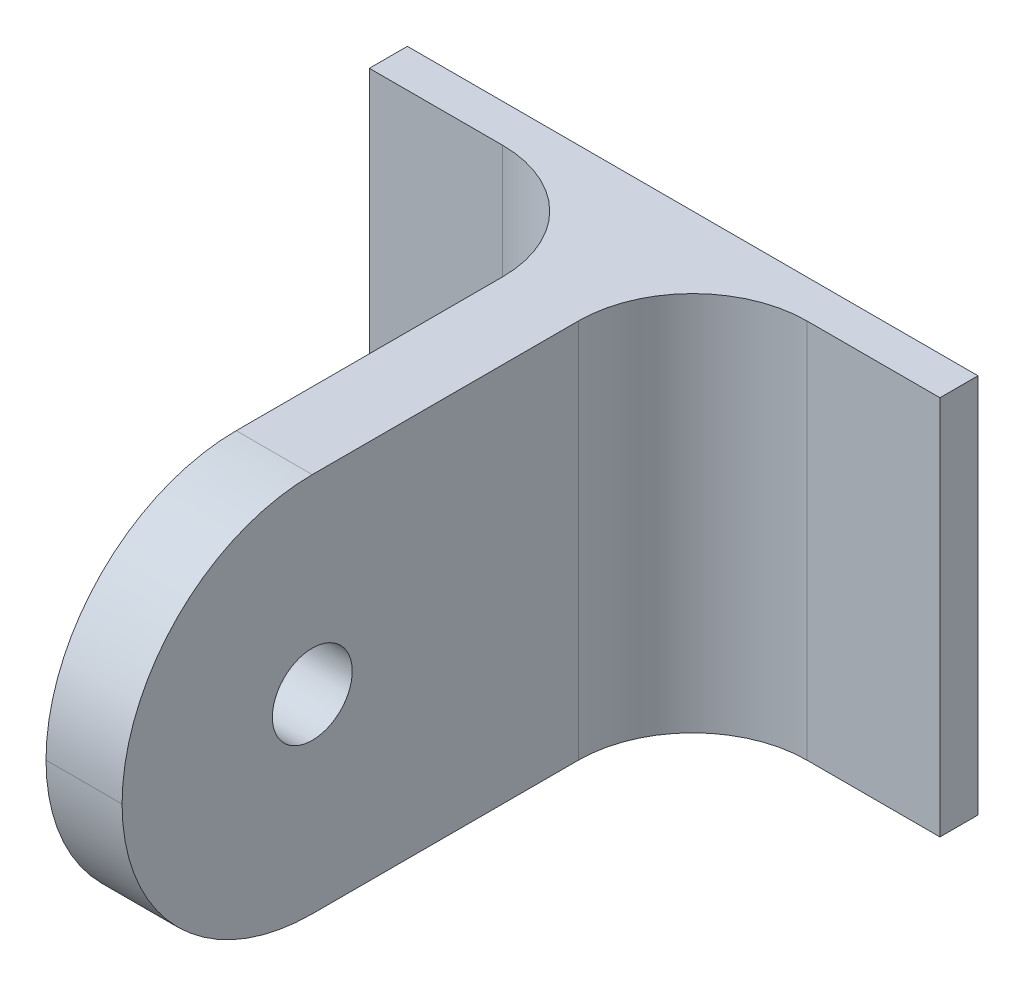
from build123d import *

# Parameters (mm, degrees)
SKETCH_4_W          = 30
SKETCH_4_H          = 20
EXTRUDE_1_DEPTH     = 2
SKETCH_5_W          = 4
SKETCH_5_H          = 20
EXTRUDE_2_DEPTH     = 30
FILLET_1_R          = 10
SKETCH_6_R          = 2.1
CUT_EXTRUDE_2_DEPTH = 30
FILLET_2_R          = 6


with BuildPart() as part:
    # 草图4 → 凸台-拉伸1 (new body)
    with BuildSketch(Plane.XY):
        with Locations((-9.056603774, -12.830188679)):
            Rectangle(SKETCH_4_W, SKETCH_4_H)
    extrude(amount=EXTRUDE_1_DEPTH)

    # 草图5 → 凸台-拉伸2 (add)
    with BuildSketch(Plane.XY.offset(2)):
        with Locations((-9.056603774, -12.830188679)):
            Rectangle(SKETCH_5_W, SKETCH_5_H)
    extrude(amount=EXTRUDE_2_DEPTH)

    # 圆角1
    fillet_1_edges = [part.edges().sort_by_distance(p)[0] for p in [
        (-9.056603774, -2.830188679, 32),
        (-9.056603774, -22.830188679, 32),
    ]]
    fillet(fillet_1_edges, radius=FILLET_1_R - 0.0001)  # a hair under: the kernel refuses the full size

    # 草图6 → 切除-拉伸2 (cut)
    with BuildSketch(Plane.ZY.offset(11.056603774)):
        with Locations(Location((22, -12.830188679, 0), (0, 0, 270))):
            Circle(SKETCH_6_R)
    extrude(amount=-CUT_EXTRUDE_2_DEPTH, mode=Mode.SUBTRACT)

    # 圆角2
    fillet_2_edges = [part.edges().sort_by_distance(p)[0] for p in [
        (-11.056603774, -12.830188679, 2),
        (-7.056603774, -12.830188679, 2),
    ]]
    fillet(fillet_2_edges, radius=FILLET_2_R)


solid = part.part
